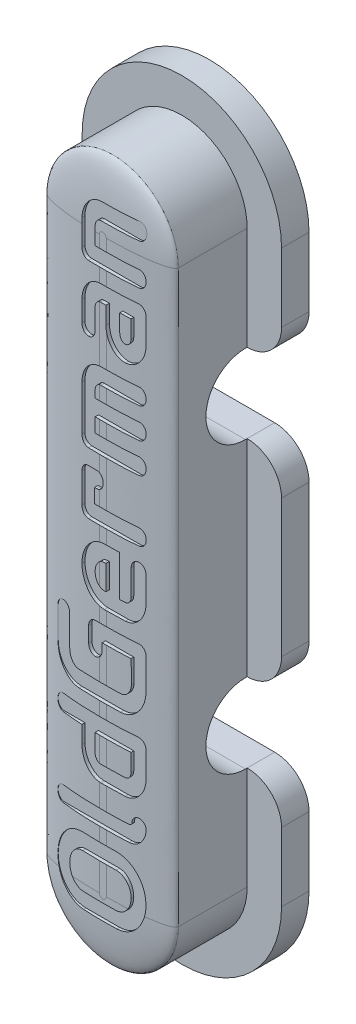
from build123d import *

# Parameters (mm, degrees)
EXTRUDE_1_DEPTH     = 3.1
EXTRUDE_2_DEPTH     = 0.8
FILLET_1_SIZE       = 0.3
FILLET_1_SIZE_2     = 1.8
SKETCH_3_R          = 1
SKETCH_3_R_2        = 1.096749421
EXTRUDE_3_DEPTH     = 1.05
SKETCH_6_W          = 5.8
SKETCH_6_H          = 2.3
CUT_EXTRUDE_2_DEPTH = 2
FILLET_4_R          = 1
FILLET_2_R          = 1.15
FILLET_3_R          = 1.15
FILLET_5_R          = 0.9
CUT_EXTRUDE_3_DEPTH = 0.1


# Some blends are built 0.0001 mm under size
with BuildPart() as part:
    # 草图1 → 凸台-拉伸1 (new body)
    with BuildSketch(Plane.XY):
        with BuildLine():
            Line((-1.3, -78.273), (-1.3, -61.672998253))
            ThreePointArc((-1.3, -61.672998253), (0.6, -59.772998253), (2.5, -61.672998253))
            Line((2.5, -61.672998253), (2.5, -78.273))
            ThreePointArc((2.5, -78.273), (0.6, -80.173), (-1.3, -78.273))
        make_face()
    extrude(amount=EXTRUDE_1_DEPTH)

    # 草图2 → 凸台-拉伸2 (add)
    with BuildSketch(Plane(origin=(0, 0, 0), x_dir=(-1, 0, 0), z_dir=(0, 0, -1))):
        with BuildLine():
            Line((2.3, -78.273), (2.3, -61.672998253))
            ThreePointArc((2.3, -61.672998253), (-0.6, -58.772998253), (-3.5, -61.672998253))
            Line((-3.5, -61.672998253), (-3.5, -78.273))
            ThreePointArc((-3.5, -78.273), (-0.6, -81.173), (2.3, -78.273))
        make_face()
    extrude(amount=-EXTRUDE_2_DEPTH)

    # 圆角1
    # an asymmetric fillet: 1.8, 0.3 mm, written as the material it takes off along each edge
    with BuildSketch(Plane(origin=(2.5, -61.672998253, 3.1), x_dir=(0, 0, -1), z_dir=(0, -1, 0)), Plane(origin=(-1.3, -78.273, 3.1), x_dir=(0, 0, -1), z_dir=(0, 1, 0))) as fillet_1_piece_1:
        with BuildLine():
            Bezier((FILLET_1_SIZE, 0), (0, 0), (0, -FILLET_1_SIZE_2), weights=[1, 0.707106781, 1])
            Line((0, -FILLET_1_SIZE_2), (0, 0))
            Line((0, 0), (FILLET_1_SIZE, 0))
        make_face()
    extrude(amount=16.600001747, mode=Mode.SUBTRACT)
    with BuildSketch(Plane(origin=(0.6, -61.672998253, 3.1), x_dir=(-1, 0, 0), z_dir=(0, -1, 0))) as fillet_1_piece_2:
        with BuildLine():
            Bezier((1.9, FILLET_1_SIZE), (1.9, 0), (1.9 - FILLET_1_SIZE_2, 0), weights=[1, 0.707106781, 1])
            Line((1.9 - FILLET_1_SIZE_2, 0), (1.9, 0))
            Line((1.9, 0), (1.9, FILLET_1_SIZE))
        make_face()
    revolve(axis=Axis((0.6, -61.672998253, 3.1), (0, 0, -1)), revolution_arc=180, mode=Mode.SUBTRACT)
    with BuildSketch(Plane(origin=(0.6, -78.273, 3.1), x_dir=(1, 0, 0), z_dir=(0, 1, 0))) as fillet_1_piece_3:
        with BuildLine():
            Bezier((1.9, FILLET_1_SIZE), (1.9, 0), (1.9 - FILLET_1_SIZE_2, 0), weights=[1, 0.707106781, 1])
            Line((1.9 - FILLET_1_SIZE_2, 0), (1.9, 0))
            Line((1.9, 0), (1.9, FILLET_1_SIZE))
        make_face()
    revolve(axis=Axis((0.6, -78.273, 3.1), (0, 0, -1)), revolution_arc=180, mode=Mode.SUBTRACT)

    # 草图3 → 凸台-拉伸3 (add)
    with BuildSketch(Plane(origin=(0, 0, 0), x_dir=(-1, 0, 0), z_dir=(0, 0, -1))):
        with Locations(Location((-0.6, -61.672998253, 0), (0, 0, 180))):
            Circle(SKETCH_3_R)
        with Locations(Location((-0.6, -69.972999126, 0), (0, 0, 180))):
            Circle(SKETCH_3_R_2)
        with Locations(Location((-0.6, -78.273, 0), (0, 0, 180))):
            Circle(SKETCH_3_R_2)
    extrude(amount=EXTRUDE_3_DEPTH)

    # 草图6 → 切除-拉伸2 (cut)
    with BuildSketch(Plane(origin=(0, 0, 0), x_dir=(-1, 0, 0), z_dir=(0, 0, -1))):
        with Locations((-0.6, -74.122999563)):
            Rectangle(SKETCH_6_W, SKETCH_6_H)
        with Locations((-0.6, -65.822998689)):
            Rectangle(SKETCH_6_W, SKETCH_6_H)
    extrude(amount=-CUT_EXTRUDE_2_DEPTH, mode=Mode.SUBTRACT)

    # 圆角4
    fillet_4_edges = [part.edges().sort_by_distance(p)[0] for p in [
        (-2.3, -75.272999563, 0.4),
        (-2.3, -64.672998689, 0.4),
        (3.5, -64.672998689, 0.4),
        (3.5, -66.972998689, 0.4),
        (-2.3, -66.972998689, 0.4),
        (-2.3, -72.972999563, 0.4),
        (3.5, -72.972999563, 0.4),
        (3.5, -75.272999563, 0.4),
    ]]
    fillet(fillet_4_edges, radius=FILLET_4_R)

    # 圆角2
    fillet_2_edges = [part.edges().sort_by_distance(p)[0] for p in [
        (0.6, -72.972999563, 2),
        (0.6, -75.272999563, 2),
    ]]
    fillet(fillet_2_edges, radius=FILLET_2_R - 0.0001)  # a hair under: the kernel refuses the full size

    # 圆角3
    fillet_3_edges = [part.edges().sort_by_distance(p)[0] for p in [
        (0.6, -66.972998689, 2),
        (0.6, -64.672998689, 2),
    ]]
    fillet(fillet_3_edges, radius=FILLET_3_R - 0.0001)  # a hair under: the kernel refuses the full size

    # 圆角5
    fillet_5_edges = [part.edges().sort_by_distance(p)[0] for p in [
        (-0.4, -61.672998253, 0),
        (-0.496749421, -69.972999126, 0),
        (-0.496749421, -78.273, 0),
    ]]
    fillet(fillet_5_edges, radius=FILLET_5_R)

    # 草图5 → 切除-拉伸3 (cut)
    # profile 1 of 9: a face of its own
    with BuildSketch(Plane.XY.offset(3.1)):
        with BuildLine():
            add(Edge.make_bspline(
                [(0.011216935, -76.987384224), (-0.016693673, -76.989324886), (-0.071778271, -76.993154994), (-0.152534844, -77.007935519), (-0.229669633, -77.031521379), (-0.303588619, -77.062633528), (-0.373743356, -77.102647355), (-0.440186185, -77.151061292), (-0.502597708, -77.208189748), (-0.561433758, -77.272268708), (-0.615248745, -77.342612369), (-0.661793995, -77.418839899), (-0.701938388, -77.499099179), (-0.735581561, -77.583892702), (-0.761916139, -77.673041916), (-0.780635247, -77.766821819), (-0.793766466, -77.864800436), (-0.796514307, -77.931865484), (-0.797916226, -77.966081346)],
                knots=[0, 0, 0, 0, 0.95443879, 1.883687951, 2.794728447, 3.702609083, 4.615393729, 5.544992927, 6.50269007, 7.498414936, 8.510915785, 9.520431137, 10.542172269, 11.570437658, 12.630057297, 13.710135553, 14.831735924, 16, 16, 16, 16], degree=3))
            add(Edge.make_bspline(
                [(-0.797916226, -77.966081346), (-0.796520158, -78.000298626), (-0.793783785, -78.067366454), (-0.780547104, -78.16549635), (-0.762109547, -78.259349444), (-0.735345473, -78.348540719), (-0.702087362, -78.433473361), (-0.661774079, -78.513843794), (-0.615254182, -78.590081026), (-0.561431926, -78.660420907), (-0.502599609, -78.724505176), (-0.440180644, -78.781616953), (-0.373762931, -78.830089969), (-0.303456771, -78.869923224), (-0.22980601, -78.901848656), (-0.152512984, -78.925204914), (-0.071831816, -78.940204966), (-0.016744611, -78.943593303), (0.011148814, -78.945308988)],
                knots=[0, 0, 0, 0, 1.16776754, 2.288891207, 3.374398935, 4.427806753, 5.461224648, 6.482531519, 7.491617807, 8.503688322, 9.498989984, 10.456280087, 11.385484186, 12.29788088, 13.207740602, 14.118393886, 15.047248097, 16, 16, 16, 16], degree=3))
            Line((0.011148814, -78.945308988), (0.986564766, -78.944781049))
            add(Edge.make_bspline(
                [(0.986564766, -78.944781049), (1.014322561, -78.943281032), (1.069290135, -78.940310611), (1.149807841, -78.925170219), (1.22710432, -78.901857832), (1.300754418, -78.869920879), (1.371059792, -78.830090161), (1.437481425, -78.781618633), (1.499884823, -78.724497901), (1.558778249, -78.660449628), (1.612423336, -78.58989817), (1.659815062, -78.514157614), (1.69920824, -78.433297124), (1.73274274, -78.348578005), (1.75922303, -78.259270536), (1.778563373, -78.165573165), (1.7915581, -78.067355429), (1.794328753, -78.000294902), (1.79574231, -77.966081346)],
                knots=[0, 0, 0, 0, 0.947768255, 1.876824959, 2.787676769, 3.697734842, 4.610330441, 5.539737109, 6.497235903, 7.492754544, 8.505045693, 9.517515298, 10.536370766, 11.570013949, 12.623651414, 13.710609808, 14.831977884, 16, 16, 16, 16], degree=3))
            add(Edge.make_bspline(
                [(1.79574231, -77.966081346), (1.794322796, -77.931869251), (1.791540468, -77.864811586), (1.778652269, -77.766744428), (1.759027662, -77.673121631), (1.732979203, -77.583855214), (1.699060653, -77.499274725), (1.659835165, -77.418525991), (1.612417854, -77.342795247), (1.558780091, -77.272239983), (1.49988292, -77.208197024), (1.437486966, -77.151059614), (1.371040222, -77.102647154), (1.30088625, -77.062635905), (1.226968, -77.0315121), (1.149829477, -77.007970702), (1.069124546, -76.993026058), (1.014040593, -76.989630139), (0.986148814, -76.987910615)],
                knots=[0, 0, 0, 0, 1.168232789, 2.289803123, 3.371073312, 4.430664575, 5.458902426, 6.477941663, 7.490593884, 8.503067617, 9.498765817, 10.456437313, 11.386011615, 12.298771817, 13.206628139, 14.117644237, 15.046868512, 16, 16, 16, 16], degree=3))
            Line((0.986148814, -76.987910615), (0.011216935, -76.987384224))
        make_face()
        with BuildLine():
            add(Edge.make_bspline(
                [(0.986564766, -77.456652516), (1.000714861, -77.457862133), (1.028775619, -77.460260899), (1.070080782, -77.467306756), (1.10966371, -77.4796448), (1.147029858, -77.496751748), (1.183064778, -77.51744336), (1.216830221, -77.543138422), (1.249159238, -77.572734821), (1.279252601, -77.60656701), (1.306165186, -77.643859441), (1.330997478, -77.683088646), (1.351451063, -77.724981997), (1.368492129, -77.768993396), (1.381524152, -77.815235617), (1.391776058, -77.863565653), (1.397956101, -77.914148183), (1.399616993, -77.948627482), (1.400457757, -77.966081346)],
                knots=[0, 0, 0, 0, 0.939469275, 1.863041863, 2.766166559, 3.673791904, 4.577292511, 5.509647286, 6.474716113, 7.473535843, 8.499192312, 9.51466749, 10.541448982, 11.578169742, 12.633137513, 13.716561243, 14.84409392, 16, 16, 16, 16], degree=3))
            add(Edge.make_bspline(
                [(1.400457757, -77.966081346), (1.399636278, -77.983713686), (1.398029604, -78.018199545), (1.391655472, -78.068928345), (1.381609295, -78.117296775), (1.368482217, -78.163695827), (1.351453672, -78.207709659), (1.330996789, -78.249602362), (1.306165376, -78.288831768), (1.279252536, -78.326124033), (1.249159308, -78.359956668), (1.216830014, -78.389551523), (1.183065504, -78.415252051), (1.147027237, -78.435923987), (1.109673532, -78.453104108), (1.070013112, -78.46517738), (1.02873391, -78.473298868), (1.000453678, -78.475119682), (0.986148814, -78.476040696)],
                knots=[0, 0, 0, 0, 1.165960287, 2.280420115, 3.373774092, 4.42731502, 5.462633617, 6.488026387, 7.502128136, 8.526397406, 9.523866233, 10.487629805, 11.418723571, 12.321002194, 13.227399977, 14.129303198, 15.053753771, 16, 16, 16, 16], degree=3))
            Line((0.986148814, -78.476040696), (0.011216935, -78.475512757))
            add(Edge.make_bspline(
                [(0.011216935, -78.475512757), (-0.003114509, -78.474815909), (-0.03143892, -78.473438671), (-0.072712632, -78.46514174), (-0.112376653, -78.453113605), (-0.14972945, -78.435921473), (-0.185767762, -78.415252667), (-0.219533033, -78.389551661), (-0.251859073, -78.359955406), (-0.281965131, -78.32612918), (-0.30882866, -78.288812038), (-0.333802337, -78.249740601), (-0.353545463, -78.207574804), (-0.370539765, -78.163619103), (-0.384482584, -78.117393946), (-0.394275678, -78.068913157), (-0.400877964, -78.018220087), (-0.402038473, -77.983717507), (-0.402631674, -77.966081346)],
                knots=[0, 0, 0, 0, 0.946924655, 1.871484914, 2.773495147, 3.680000475, 4.582386154, 5.513590395, 6.477468318, 7.475055495, 8.499446295, 9.513668368, 10.53408351, 11.569524948, 12.626464836, 13.719948541, 14.8345406, 16, 16, 16, 16], degree=3))
            add(Edge.make_bspline(
                [(-0.402631674, -77.966081346), (-0.402018726, -77.948623672), (-0.400807541, -77.914127318), (-0.394395595, -77.86358098), (-0.384395341, -77.815139039), (-0.370549457, -77.769070176), (-0.353542929, -77.725116833), (-0.333803008, -77.682950411), (-0.308828474, -77.64387917), (-0.281965194, -77.606561864), (-0.251859005, -77.57273608), (-0.219533237, -77.543138294), (-0.185767048, -77.517442713), (-0.149732028, -77.496754375), (-0.112366992, -77.479634876), (-0.072779702, -77.467343959), (-0.031371025, -77.460096433), (-0.003144923, -77.458159681), (0.011148814, -77.457178907)],
                knots=[0, 0, 0, 0, 1.154856541, 2.281995816, 3.365041533, 4.422918079, 5.459277122, 6.480596553, 7.495717427, 8.521016039, 9.519487276, 10.484219384, 11.416248856, 12.319434227, 13.226742898, 14.129552489, 15.052802838, 16, 16, 16, 16], degree=3))
            Line((0.011148814, -77.457178907), (0.986564766, -77.456652516))
        make_face(mode=Mode.SUBTRACT)
    # profile 2 of 9: a face of its own
    with BuildSketch(Plane.XY.offset(3.1)):
        with BuildLine():
            add(Edge.make_bspline(
                [(1.801026863, -76.084072073), (1.800123807, -76.068356418), (1.798386085, -76.038115276), (1.78759114, -75.994787621), (1.770052804, -75.956056416), (1.74679492, -75.921854279), (1.718350115, -75.893924974), (1.686072691, -75.872505654), (1.649581762, -75.859387941), (1.623921389, -75.857050502), (1.610782961, -75.855853704)],
                knots=[0, 0, 0, 0, 1.146539465, 2.20624998, 3.235764897, 4.233840532, 5.206185862, 6.125809605, 7.040391315, 8, 8, 8, 8], degree=3))
            add(Edge.make_bspline(
                [(1.610782961, -75.855853704), (1.597298643, -75.857058003), (1.570963332, -75.859410039), (1.533535018, -75.872359444), (1.500578544, -75.893900341), (1.471694487, -75.921852823), (1.447628544, -75.95576471), (1.430978903, -75.994949122), (1.419949145, -76.0381139), (1.418251316, -76.068397046), (1.417368326, -76.084146387)],
                knots=[0, 0, 0, 0, 0.976100452, 1.9063559, 2.828294777, 3.800900527, 4.797142443, 5.812088704, 6.862134105, 8, 8, 8, 8], degree=3))
            add(Edge.make_bspline(
                [(1.417368326, -76.084146387), (1.413029886, -76.09035136), (1.404743569, -76.10220271), (1.388953271, -76.115912737), (1.372291255, -76.126913748), (1.359732739, -76.130104707), (1.353425237, -76.131707362)],
                knots=[0, 0, 0, 0, 1.106007569, 2.112448186, 3.051979138, 4, 4, 4, 4], degree=3))
            Line((1.353425237, -76.131707362), (-0.613294386, -76.131456037))
            add(Edge.make_bspline(
                [(-0.613294386, -76.131456037), (-0.626332318, -76.132520535), (-0.651748529, -76.134595675), (-0.687812771, -76.148014779), (-0.719995084, -76.16906274), (-0.747871771, -76.197393246), (-0.771125436, -76.231124914), (-0.788203361, -76.269625091), (-0.798314893, -76.312469487), (-0.800137469, -76.342330065), (-0.801086958, -76.357886224)],
                knots=[0, 0, 0, 0, 0.959435098, 1.870327626, 2.79850931, 3.770688842, 4.778052484, 5.800006748, 6.853892094, 8, 8, 8, 8], degree=3))
            add(Edge.make_bspline(
                [(-0.801086958, -76.357886224), (-0.800119346, -76.373438526), (-0.79825133, -76.403462882), (-0.788302449, -76.446522091), (-0.771124858, -76.485185523), (-0.747846498, -76.518866988), (-0.720157741, -76.547314187), (-0.68764317, -76.567683086), (-0.651809024, -76.581120538), (-0.62646265, -76.583417499), (-0.613485332, -76.584593541)],
                knots=[0, 0, 0, 0, 1.145841184, 2.212093514, 3.233809949, 4.240939159, 5.212892446, 6.133855195, 7.044535741, 8, 8, 8, 8], degree=3))
            Line((-0.613485332, -76.584593541), (1.353542385, -76.584065602))
            add(Edge.make_bspline(
                [(1.353542385, -76.584065602), (1.368689789, -76.583364497), (1.398695092, -76.581975686), (1.44254165, -76.573701298), (1.484808838, -76.561656007), (1.524961504, -76.544584692), (1.563269844, -76.523385749), (1.599380513, -76.497632067), (1.634045193, -76.468059594), (1.665777535, -76.433641539), (1.695410488, -76.396658974), (1.720619814, -76.356480474), (1.743382884, -76.31479934), (1.760741864, -76.270161817), (1.776272437, -76.223817112), (1.786263446, -76.174818426), (1.793488423, -76.123628722), (1.794980213, -76.088752091), (1.79574231, -76.070935005)],
                knots=[0, 0, 0, 0, 0.969050169, 1.91957938, 2.846842253, 3.776157352, 4.704378495, 5.642399312, 6.609289039, 7.613865083, 8.632938648, 9.636439501, 10.644738196, 11.665990401, 12.69597274, 13.768007411, 14.859763632, 16, 16, 16, 16], degree=3))
            Line((1.79574231, -76.070935005), (1.801026863, -76.084072073))
        make_face()
    # profile 3 of 9: a face of its own
    with BuildSketch(Plane.XY.offset(3.1)):
        with BuildLine():
            add(Edge.make_bspline(
                [(1.238390224, -75.474732269), (1.257417355, -75.473822138), (1.294933342, -75.472027625), (1.349658376, -75.460709216), (1.402561479, -75.445274895), (1.452745611, -75.42250202), (1.501405955, -75.395274149), (1.546713024, -75.360796399), (1.590431011, -75.321744856), (1.630656686, -75.276723475), (1.668085715, -75.227999586), (1.701113018, -75.175583988), (1.728311271, -75.119685304), (1.751931084, -75.061368377), (1.77022146, -74.999935673), (1.784193201, -74.935674074), (1.79244788, -74.868260832), (1.79462959, -74.822285754), (1.79574231, -74.798837444)],
                knots=[0, 0, 0, 0, 0.942526683, 1.858389432, 2.761349701, 3.668015128, 4.582879026, 5.518617029, 6.482748756, 7.483867004, 8.505178413, 9.524809879, 10.547575006, 11.581712154, 12.639343413, 13.719640775, 14.836966202, 16, 16, 16, 16], degree=3))
            Line((1.79574231, -74.798837444), (1.79574231, -74.058596995))
            add(Edge.make_bspline(
                [(1.79574231, -74.058596995), (1.794877315, -74.04262684), (1.793194835, -74.011563705), (1.781680787, -73.967297722), (1.764327523, -73.926799963), (1.739816042, -73.891712002), (1.711075602, -73.86158281), (1.677270509, -73.839590168), (1.639626451, -73.825650929), (1.613190872, -73.823401349), (1.5996854, -73.822252078)],
                knots=[0, 0, 0, 0, 1.126897176, 2.191898422, 3.211167379, 4.222128699, 5.198519621, 6.133542748, 7.046459767, 8, 8, 8, 8], degree=3))
            Line((1.5996854, -73.822252078), (-0.612145615, -73.821725171))
            add(Edge.make_bspline(
                [(-0.612145615, -73.821725171), (-0.625206809, -73.82311147), (-0.650830191, -73.825831106), (-0.687353683, -73.839434411), (-0.719670585, -73.861854188), (-0.747357048, -73.891733751), (-0.770667103, -73.927005155), (-0.787619892, -73.967317066), (-0.798425441, -74.011772391), (-0.800180011, -74.0429066), (-0.801086958, -74.059000045)],
                knots=[0, 0, 0, 0, 0.938112965, 1.840385105, 2.757270954, 3.730092353, 4.74142436, 5.770234776, 6.847421918, 8, 8, 8, 8], degree=3))
            add(Edge.make_bspline(
                [(-0.801086958, -74.059000045), (-0.800179945, -74.074917753), (-0.798425658, -74.105704776), (-0.787625915, -74.149644574), (-0.770637343, -74.189417489), (-0.747488982, -74.2241204), (-0.719639727, -74.253129536), (-0.687035895, -74.274162482), (-0.650994428, -74.288084545), (-0.62541118, -74.290363743), (-0.612428422, -74.291520371)],
                knots=[0, 0, 0, 0, 1.152628329, 2.229340808, 3.257817537, 4.269704843, 5.23492312, 6.147806245, 7.060065237, 8, 8, 8, 8], degree=3))
            Line((-0.612428422, -74.291520371), (-0.020029532, -74.290993464))
            Line((-0.020029532, -74.290993464), (-0.020029532, -74.798766742))
            add(Edge.make_bspline(
                [(-0.020029532, -74.798766742), (-0.018918068, -74.822238774), (-0.016739892, -74.868237794), (-0.008478294, -74.93567296), (0.005481963, -74.99993963), (0.023812976, -75.061354073), (0.047315159, -75.119810338), (0.075139178, -75.175617164), (0.108754944, -75.227828963), (0.146047637, -75.276939385), (0.18690755, -75.321540448), (0.230594289, -75.361007781), (0.276372154, -75.395106252), (0.325063484, -75.422520487), (0.375412438, -75.445367059), (0.428704718, -75.460731687), (0.483859445, -75.471869778), (0.521582285, -75.474121417), (0.540661009, -75.475260208)],
                knots=[0, 0, 0, 0, 1.161077911, 2.275407906, 3.352809105, 4.407604967, 5.438969703, 6.462886066, 7.484431221, 8.503004602, 9.50730425, 10.468851242, 11.409078786, 12.32149003, 13.225724783, 14.134599134, 15.056553867, 16, 16, 16, 16], degree=3))
            Line((0.540661009, -75.475260208), (1.238390224, -75.474732269))
        make_face()
        with BuildLine():
            Line((0.375255021, -74.290993464), (1.400457757, -74.290993464))
            Line((1.400457757, -74.290993464), (1.400457757, -74.798766742))
            add(Edge.make_bspline(
                [(1.400457757, -74.798766742), (1.399701138, -74.812771652), (1.398237682, -74.839860027), (1.388249114, -74.87851153), (1.373571145, -74.913799969), (1.353490967, -74.944855402), (1.329602552, -74.971193453), (1.301374556, -74.989669576), (1.271040259, -75.003062701), (1.249285649, -75.005004421), (1.238221985, -75.005991915)],
                knots=[0, 0, 0, 0, 1.158458662, 2.240697287, 3.286157774, 4.309519527, 5.289576018, 6.203619967, 7.086421449, 8, 8, 8, 8], degree=3))
            Line((1.238221985, -75.005991915), (0.540795187, -75.005463976))
            add(Edge.make_bspline(
                [(0.540795187, -75.005463976), (0.529335751, -75.004696811), (0.506833882, -75.003190399), (0.47553708, -74.989791723), (0.446660651, -74.97122593), (0.422255824, -74.94487953), (0.401585584, -74.91394434), (0.386807677, -74.878573967), (0.377651771, -74.839802023), (0.376071904, -74.812805192), (0.375254505, -74.798837444)],
                knots=[0, 0, 0, 0, 0.934576908, 1.835145018, 2.751876845, 3.731874022, 4.752687054, 5.787485867, 6.855278908, 8, 8, 8, 8], degree=3))
            Line((0.375254505, -74.798837444), (0.375255021, -74.290993464))
        make_face(mode=Mode.SUBTRACT)
    # profile 4 of 9: a face of its own
    with BuildSketch(Plane.XY.offset(3.1)):
        with BuildLine():
            add(Edge.make_bspline(
                [(1.410183605, -72.584758017), (1.40768133, -72.609808401), (1.402830763, -72.658367623), (1.383541755, -72.727384046), (1.354789715, -72.78950941), (1.31742992, -72.843841792), (1.273381111, -72.889070153), (1.223275233, -72.923045841), (1.167316524, -72.943842002), (1.128116579, -72.947705782), (1.108221985, -72.949666712)],
                knots=[0, 0, 0, 0, 1.160381443, 2.249355472, 3.289739044, 4.306923674, 5.278600684, 6.187416734, 7.080085207, 8, 8, 8, 8], degree=3))
            Line((1.108221985, -72.949666712), (-0.108083909, -72.949138773))
            add(Edge.make_bspline(
                [(-0.108083909, -72.949138773), (-0.128235844, -72.947431403), (-0.167733208, -72.944084994), (-0.223943645, -72.922867392), (-0.274422197, -72.889246064), (-0.318518316, -72.844071022), (-0.355038344, -72.789645956), (-0.38126972, -72.727326535), (-0.398971329, -72.658733866), (-0.401383419, -72.610514506), (-0.402631674, -72.585561021)],
                knots=[0, 0, 0, 0, 0.933576498, 1.829790135, 2.74901888, 3.724554832, 4.736602349, 5.767762173, 6.844818481, 8, 8, 8, 8], degree=3))
            Line((-0.402631674, -72.585561021), (-0.402630641, -71.692590802))
            add(Edge.make_bspline(
                [(-0.402630641, -71.692590802), (-0.403484215, -71.676621472), (-0.405135448, -71.645728881), (-0.41667843, -71.601798217), (-0.434013513, -71.562106123), (-0.45800069, -71.527600609), (-0.486791193, -71.498864536), (-0.520448769, -71.477578326), (-0.558306492, -71.46442858), (-0.585020777, -71.462515446), (-0.598688584, -71.461536631)],
                knots=[0, 0, 0, 0, 1.137300663, 2.200102668, 3.217432155, 4.210055022, 5.17782923, 6.097493112, 7.026622051, 8, 8, 8, 8], degree=3))
            add(Edge.make_bspline(
                [(-0.598688584, -71.461536631), (-0.612365794, -71.462499915), (-0.639098458, -71.464382694), (-0.677108995, -71.477852584), (-0.711596494, -71.498612166), (-0.740880048, -71.527757403), (-0.766040875, -71.5618848), (-0.783947707, -71.601700097), (-0.795422245, -71.645868858), (-0.797064051, -71.676895659), (-0.797916226, -71.693000045)],
                knots=[0, 0, 0, 0, 0.966165885, 1.888410615, 2.822453195, 3.791989156, 4.791655316, 5.806586792, 6.861514161, 8, 8, 8, 8], degree=3))
            Line((-0.797916226, -71.693000045), (-0.79791571, -72.585464516))
            add(Edge.make_bspline(
                [(-0.79791571, -72.585464516), (-0.796758921, -72.61459256), (-0.794488465, -72.671762818), (-0.783834002, -72.755585468), (-0.767047568, -72.83549111), (-0.743905207, -72.911480755), (-0.71650627, -72.9840563), (-0.681524715, -73.052341442), (-0.640906208, -73.116636388), (-0.595038875, -73.176863722), (-0.544853895, -73.231450667), (-0.490962965, -73.279258384), (-0.434967159, -73.321012808), (-0.375372531, -73.355147695), (-0.312519065, -73.381358975), (-0.247193618, -73.401882238), (-0.178675722, -73.414621035), (-0.13193647, -73.417485381), (-0.10828208, -73.418935005)],
                knots=[0, 0, 0, 0, 1.167827455, 2.292120889, 3.381771476, 4.43592474, 5.472919106, 6.486361953, 7.504808276, 8.517168701, 9.516323912, 10.471334558, 11.400396663, 12.311038216, 13.215750048, 14.124556429, 15.050851903, 16, 16, 16, 16], degree=3))
            Line((-0.10828208, -73.418935005), (1.108550205, -73.418407066))
            add(Edge.make_bspline(
                [(1.108550205, -73.418407066), (1.132099844, -73.417184521), (1.178578878, -73.414771632), (1.246607218, -73.401840585), (1.311421561, -73.381384572), (1.373842379, -73.355009267), (1.433335613, -73.321034821), (1.489287286, -73.279228542), (1.543230802, -73.231631061), (1.592799502, -73.17665057), (1.638829372, -73.116819698), (1.678777486, -73.052186354), (1.713661572, -72.983946519), (1.742031045, -72.911700564), (1.764119278, -72.835370442), (1.781230092, -72.755607337), (1.791629922, -72.671771553), (1.794354607, -72.614652302), (1.79574231, -72.585561021)],
                knots=[0, 0, 0, 0, 0.946232588, 1.867543542, 2.771525593, 3.671651626, 4.584229579, 5.515267253, 6.472308646, 7.468803567, 8.483316688, 9.500170379, 10.515768225, 11.557541049, 12.611920467, 13.7038881, 14.830572247, 16, 16, 16, 16], degree=3))
            Line((1.79574231, -72.585561021), (1.79574231, -71.692590802))
            add(Edge.make_bspline(
                [(1.79574231, -71.692590802), (1.794941132, -71.676607937), (1.793389012, -71.645644381), (1.781093326, -71.601786028), (1.763382666, -71.561873158), (1.738166298, -71.527760403), (1.708897009, -71.498611405), (1.674405878, -71.47785278), (1.636396282, -71.464382642), (1.609663488, -71.462499898), (1.595986213, -71.461536631)],
                knots=[0, 0, 0, 0, 1.129783229, 2.188725572, 3.204476398, 4.204949585, 5.175268249, 6.110064878, 7.033054133, 8, 8, 8, 8], degree=3))
            Line((1.595986213, -71.461536631), (0.382398457, -71.46101024))
            add(Edge.make_bspline(
                [(0.382398457, -71.46101024), (0.368634031, -71.462186172), (0.341837846, -71.464475442), (0.303699634, -71.477817962), (0.269217742, -71.498621878), (0.239932615, -71.52775467), (0.214772228, -71.561885553), (0.196865274, -71.601699886), (0.185390771, -71.645868916), (0.18374896, -71.676895679), (0.182896782, -71.693000045)],
                knots=[0, 0, 0, 0, 0.973130344, 1.894461925, 2.827579675, 3.796155663, 4.794832016, 5.808758571, 6.862641418, 8, 8, 8, 8], degree=3))
            Line((0.182896782, -71.693000045), (0.182897298, -72.133968629))
            add(Edge.make_bspline(
                [(0.182897298, -72.133968629), (0.183758473, -72.150166495), (0.185421928, -72.181454447), (0.196834243, -72.226095248), (0.214926678, -72.266458971), (0.239708194, -72.301587393), (0.269367582, -72.331158268), (0.303483366, -72.353178084), (0.341674928, -72.367073914), (0.368446531, -72.369328055), (0.382124424, -72.37047972)],
                knots=[0, 0, 0, 0, 1.134260005, 2.19094747, 3.207293139, 4.21739958, 5.186168446, 6.124261137, 7.041665307, 8, 8, 8, 8], degree=3))
            add(Edge.make_bspline(
                [(0.382124424, -72.37047972), (0.395792363, -72.369312445), (0.422544484, -72.36702775), (0.460596582, -72.353455744), (0.493862719, -72.330907185), (0.523039923, -72.301738142), (0.546642762, -72.266244159), (0.564165195, -72.22599764), (0.575657112, -72.181556479), (0.577321941, -72.150362633), (0.578181335, -72.134260208)],
                knots=[0, 0, 0, 0, 0.964998293, 1.888781459, 2.812564626, 3.779242082, 4.782304087, 5.800648234, 6.864683176, 8, 8, 8, 8], degree=3))
            Line((0.578181335, -72.134260208), (0.578181851, -71.928574987))
            Line((0.578181851, -71.928574987), (1.400457757, -71.928574987))
            Line((1.400457757, -71.928574987), (1.410183605, -72.584758017))
        make_face()
    # profile 5 of 9: a face of its own
    with BuildSketch(Plane.XY.offset(3.1)):
        with BuildLine():
            Line((1.085498924, -69.40468452), (0.64619002, -69.40468452))
            add(Edge.make_bspline(
                [(0.64619002, -69.40468452), (0.623642624, -69.406341023), (0.579064, -69.409616107), (0.513852183, -69.422425246), (0.451201487, -69.442099602), (0.391355716, -69.469270779), (0.333988606, -69.503346147), (0.279136607, -69.544319885), (0.22739637, -69.592801347), (0.178548365, -69.647425848), (0.133978037, -69.707476871), (0.093962949, -69.771351264), (0.06082983, -69.839603029), (0.032604527, -69.911068652), (0.010355044, -69.986587315), (-0.005773967, -70.065800766), (-0.016640611, -70.148642483), (-0.018886289, -70.205083203), (-0.020030048, -70.233829314)],
                knots=[0, 0, 0, 0, 0.923665058, 1.82618503, 2.709918895, 3.60276125, 4.506860185, 5.433005949, 6.39613021, 7.400896498, 8.42498895, 9.450220282, 10.477649867, 11.522126638, 12.588568936, 13.69165935, 14.824327235, 16, 16, 16, 16], degree=3))
            add(Edge.make_bspline(
                [(-0.020030048, -70.233829314), (-0.018892059, -70.262399798), (-0.016664874, -70.318315793), (-0.005788281, -70.400283569), (0.010437779, -70.478590905), (0.032574317, -70.553440581), (0.060978402, -70.624468039), (0.093794336, -70.692533478), (0.134146779, -70.756029287), (0.178554363, -70.815988041), (0.227218584, -70.8706485), (0.27931947, -70.918561936), (0.333970185, -70.959568343), (0.391346297, -70.993671315), (0.451305342, -71.02065795), (0.51374637, -71.041136364), (0.578931084, -71.053876014), (0.623399689, -71.056763501), (0.645823611, -71.058219558)],
                knots=[0, 0, 0, 0, 1.173145474, 2.295991786, 3.389326865, 4.45309377, 5.495012025, 6.526542102, 7.549726577, 8.577906204, 9.586682534, 10.54874524, 11.478587271, 12.386294483, 13.282700191, 14.172167919, 15.078289867, 16, 16, 16, 16], degree=3))
            Line((0.645823611, -71.058219558), (1.244681112, -71.057691618))
            add(Edge.make_bspline(
                [(1.244681112, -71.057691618), (1.263375548, -71.056787788), (1.300214871, -71.055006695), (1.354046923, -71.043575142), (1.406139884, -71.028337882), (1.45541973, -71.005457053), (1.503083214, -70.978061169), (1.54780643, -70.943776716), (1.590984527, -70.904532877), (1.631154508, -70.859675534), (1.66874788, -70.811140773), (1.700859854, -70.758213446), (1.72913985, -70.702942041), (1.751727004, -70.644170774), (1.77028309, -70.582921266), (1.784176007, -70.518626102), (1.792452447, -70.451222126), (1.794631132, -70.40524576), (1.79574231, -70.381796793)],
                knots=[0, 0, 0, 0, 0.931216621, 1.83505887, 2.734756502, 3.630548451, 4.535413243, 5.469444943, 6.432560396, 7.439371832, 8.466491262, 9.487288971, 10.519796213, 11.556586114, 12.62023194, 13.706672766, 14.830352229, 16, 16, 16, 16], degree=3))
            Line((1.79574231, -70.381796793), (1.79574231, -69.641556345))
            add(Edge.make_bspline(
                [(1.79574231, -69.641556345), (1.794877315, -69.625586189), (1.793194835, -69.594523055), (1.781680787, -69.550257071), (1.764327523, -69.509759313), (1.739816042, -69.474671351), (1.711075602, -69.44454216), (1.677270509, -69.422549518), (1.639626451, -69.408610279), (1.613190872, -69.406360699), (1.5996854, -69.405211428)],
                knots=[0, 0, 0, 0, 1.126897176, 2.191898422, 3.211167379, 4.222128699, 5.198519621, 6.133542748, 7.046459767, 8, 8, 8, 8], degree=3))
            add(Edge.make_bspline(
                [(1.5996854, -69.405211428), (1.585835153, -69.406368468), (1.558727425, -69.408633029), (1.520128377, -69.422392978), (1.485706331, -69.444544681), (1.456371373, -69.474489213), (1.431895354, -69.509781135), (1.414513334, -69.550250914), (1.402971154, -69.594655176), (1.401313465, -69.625854264), (1.400457757, -69.641959395)],
                knots=[0, 0, 0, 0, 0.96891525, 1.896362752, 2.832850791, 3.808635652, 4.809989248, 5.819571528, 6.874451479, 8, 8, 8, 8], degree=3))
            Line((1.400457757, -69.641959395), (1.400457757, -70.381726092))
            add(Edge.make_bspline(
                [(1.400457757, -70.381726092), (1.399652521, -70.395721252), (1.398097422, -70.422749164), (1.388807676, -70.461428049), (1.374659865, -70.496741846), (1.355064492, -70.527601318), (1.332313529, -70.554095223), (1.305109626, -70.57259413), (1.275997108, -70.58594204), (1.255099496, -70.587942622), (1.244563448, -70.588951265)],
                knots=[0, 0, 0, 0, 1.177717652, 2.274446914, 3.331586134, 4.364008909, 5.340304702, 6.24509898, 7.115223326, 8, 8, 8, 8], degree=3))
            Line((1.244563448, -70.588951265), (1.085498924, -70.588423326))
            Line((1.085498924, -70.588423326), (1.085498924, -69.40468452))
        make_face()
        with BuildLine():
            add(Edge.make_bspline(
                [(0.375255021, -70.233443294), (0.376430464, -70.209168455), (0.378709521, -70.162102182), (0.394626957, -70.094763899), (0.418577032, -70.033174951), (0.452403408, -69.979462541), (0.492847331, -69.934746697), (0.538915283, -69.900857223), (0.590782882, -69.879634307), (0.627314762, -69.876213082), (0.645823611, -69.87447972)],
                knots=[0, 0, 0, 0, 1.173689533, 2.275656417, 3.331297314, 4.357595055, 5.328798802, 6.232391115, 7.10444229, 8, 8, 8, 8], degree=3))
            Line((0.645823611, -69.87447972), (0.690213855, -69.873952813))
            Line((0.690213855, -69.873952813), (0.690213855, -70.588423326))
            Line((0.690213855, -70.588423326), (0.64619002, -70.588423326))
            add(Edge.make_bspline(
                [(0.64619002, -70.588423326), (0.627537636, -70.58694309), (0.590816901, -70.584028968), (0.539259764, -70.562398532), (0.492677847, -70.529899795), (0.452435808, -70.485529989), (0.418718802, -70.432523133), (0.394513692, -70.371717634), (0.378697358, -70.304901214), (0.376428084, -70.258055862), (0.375255021, -70.233443294)],
                knots=[0, 0, 0, 0, 0.905337752, 1.782328134, 2.681120957, 3.651524479, 4.676384823, 5.722107799, 6.821964958, 8, 8, 8, 8], degree=3))
        make_face(mode=Mode.SUBTRACT)
    # profile 6 of 9: a face of its own
    with BuildSketch(Plane.XY.offset(3.1)):
        with BuildLine():
            add(Edge.make_bspline(
                [(1.611084345, -68.997465961), (1.624150045, -68.996621191), (1.64985348, -68.994959321), (1.685935248, -68.980809999), (1.718541902, -68.959663136), (1.746788083, -68.931062184), (1.770051585, -68.896394945), (1.787794932, -68.856828574), (1.798306343, -68.812349682), (1.80009981, -68.781231532), (1.801026863, -68.765146387)],
                knots=[0, 0, 0, 0, 0.939412827, 1.848055395, 2.757319621, 3.727654124, 4.724982834, 5.754491679, 6.839284224, 8, 8, 8, 8], degree=3))
            add(Edge.make_bspline(
                [(1.801026863, -68.765146387), (1.80012294, -68.749407525), (1.798384858, -68.719144527), (1.7876187, -68.675769081), (1.769892638, -68.636990154), (1.746979039, -68.602377333), (1.718331586, -68.57439983), (1.686073268, -68.553008988), (1.649619017, -68.539734471), (1.623926759, -68.53782868), (1.610782961, -68.536853704)],
                knots=[0, 0, 0, 0, 1.146794116, 2.205078657, 3.233208232, 4.240542482, 5.211579399, 6.129965672, 7.043316697, 8, 8, 8, 8], degree=3))
            Line((1.610782961, -68.536853704), (0.354541535, -68.536494519))
            Line((0.354541535, -68.536494519), (0.354541535, -68.128205528))
            Line((0.354541535, -68.128205528), (0.425646123, -68.123809131))
            add(Edge.make_bspline(
                [(0.425646123, -68.123809131), (0.438376585, -68.12273227), (0.463480133, -68.120608778), (0.499258265, -68.107295716), (0.531431506, -68.086238058), (0.559449176, -68.057845131), (0.582564388, -68.023860927), (0.599044232, -67.984651257), (0.609848102, -67.941672624), (0.611619705, -67.911405379), (0.612530928, -67.895837444)],
                knots=[0, 0, 0, 0, 0.935850102, 1.845428568, 2.772271248, 3.743048305, 4.759657985, 5.774946749, 6.85554548, 8, 8, 8, 8], degree=3))
            add(Edge.make_bspline(
                [(0.612530928, -67.895837444), (0.611633769, -67.879739627), (0.609898136, -67.848596962), (0.599015152, -67.804426274), (0.582725828, -67.764239411), (0.559425369, -67.729670289), (0.531610209, -67.700671423), (0.499237907, -67.679656794), (0.463440969, -67.666231092), (0.438255941, -67.664298962), (0.425457757, -67.663317119)],
                knots=[0, 0, 0, 0, 1.16687827, 2.257430216, 3.282265658, 4.295492622, 5.26198877, 6.176080479, 7.073145486, 8, 8, 8, 8], degree=3))
            Line((0.425457757, -67.663317119), (0.177610681, -67.66283769))
            add(Edge.make_bspline(
                [(0.177610681, -67.66283769), (0.163758264, -67.663970496), (0.13703461, -67.66615587), (0.099136075, -67.67958588), (0.065213879, -67.700608192), (0.035735304, -67.729414786), (0.011452644, -67.764190528), (-0.006083712, -67.804256249), (-0.017497767, -67.848541367), (-0.019167911, -67.879735084), (-0.020030048, -67.895837444)],
                knots=[0, 0, 0, 0, 0.979723931, 1.89005317, 2.813338772, 3.782730591, 4.785195421, 5.794837066, 6.861683421, 8, 8, 8, 8], degree=3))
            Line((-0.020030048, -67.895837444), (-0.020029532, -68.764500784))
            add(Edge.make_bspline(
                [(-0.020029532, -68.764500784), (-0.019190932, -68.780999259), (-0.017576284, -68.812765577), (-0.005956911, -68.857886739), (0.011280291, -68.89879028), (0.035762521, -68.934129726), (0.065018261, -68.963606128), (0.099266472, -68.98441192), (0.136748949, -68.998617634), (0.163388535, -69.000781781), (0.177083774, -69.001894354)],
                knots=[0, 0, 0, 0, 1.155295002, 2.224415809, 3.247480974, 4.250985735, 5.22017508, 6.13506575, 7.041249356, 8, 8, 8, 8], degree=3))
            Line((0.177083774, -69.001894354), (1.611084345, -68.997465961))
        make_face()
    # profile 7 of 9: a face of its own
    with BuildSketch(Plane.XY.offset(3.1)):
        with BuildLine():
            add(Edge.make_bspline(
                [(-0.020029532, -66.978744686), (-0.019203828, -66.994897035), (-0.017614869, -67.025980161), (-0.005751002, -67.070314501), (0.011248364, -67.110929752), (0.035888985, -67.146343491), (0.065155006, -67.176105299), (0.098941701, -67.198329985), (0.136827021, -67.212147397), (0.163407419, -67.214782449), (0.177083774, -67.216138257)],
                knots=[0, 0, 0, 0, 1.134229186, 2.182678794, 3.208944308, 4.215588229, 5.196528331, 6.127558359, 7.036576686, 8, 8, 8, 8], degree=3))
            Line((0.177083774, -67.216138257), (1.61197663, -67.215610318))
            add(Edge.make_bspline(
                [(1.61197663, -67.215610318), (1.624731675, -67.214437263), (1.649914461, -67.212121256), (1.685817887, -67.198247019), (1.718046407, -67.176037966), (1.745650837, -67.146097112), (1.769305721, -67.110873688), (1.785078581, -67.070157222), (1.796383309, -67.025959151), (1.798047866, -66.994969259), (1.798913042, -66.978861834)],
                knots=[0, 0, 0, 0, 0.918677873, 1.813781688, 2.735446954, 3.713339345, 4.729943085, 5.770937527, 6.841413916, 8, 8, 8, 8], degree=3))
            add(Edge.make_bspline(
                [(1.798913042, -66.978861834), (1.798021874, -66.962937322), (1.796298234, -66.932137137), (1.785300305, -66.888356951), (1.769117688, -66.848314762), (1.745800055, -66.813766398), (1.718011294, -66.784703089), (1.685503632, -66.763877417), (1.649943761, -66.749630611), (1.624658003, -66.747798645), (1.611839871, -66.746869964)],
                knots=[0, 0, 0, 0, 1.157147383, 2.238081277, 3.265574424, 4.281428989, 5.25043155, 6.166893773, 7.070741875, 8, 8, 8, 8], degree=3))
            Line((1.611839871, -66.746869964), (0.375255021, -66.746342025))
            Line((0.375255021, -66.746342025), (0.375255021, -66.336261756))
            Line((0.375255021, -66.336261756), (1.61197663, -66.336261756))
            add(Edge.make_bspline(
                [(1.61197663, -66.336261756), (1.624749833, -66.335329078), (1.649991024, -66.333486009), (1.685485415, -66.319234954), (1.718189564, -66.298429457), (1.745775793, -66.268769067), (1.769274941, -66.233630103), (1.785273304, -66.192617693), (1.796346475, -66.147641855), (1.798035601, -66.115966482), (1.798913042, -66.099512241)],
                knots=[0, 0, 0, 0, 0.914156149, 1.806468545, 2.71123407, 3.676933262, 4.690366682, 5.72811474, 6.819835592, 8, 8, 8, 8], degree=3))
            add(Edge.make_bspline(
                [(1.798913042, -66.099512241), (1.798021874, -66.083587728), (1.796298234, -66.052787544), (1.785300305, -66.009007357), (1.769117688, -65.968965168), (1.745800055, -65.934416805), (1.718011294, -65.905353495), (1.685503632, -65.884527824), (1.649943761, -65.870281018), (1.624658003, -65.868449051), (1.611839871, -65.867520371)],
                knots=[0, 0, 0, 0, 1.157147383, 2.238081277, 3.265574424, 4.281428989, 5.25043155, 6.166893773, 7.070741875, 8, 8, 8, 8], degree=3))
            Line((1.611839871, -65.867520371), (0.375255021, -65.866993464))
            Line((0.375255021, -65.866993464), (0.375255021, -65.659756421))
            add(Edge.make_bspline(
                [(0.375255021, -65.659756421), (0.376029884, -65.646155769), (0.377540261, -65.619645134), (0.38739761, -65.581889744), (0.402176032, -65.547091464), (0.423335824, -65.516854131), (0.448474465, -65.491224431), (0.477418577, -65.472236953), (0.50973848, -65.460697439), (0.532291798, -65.458541968), (0.543831741, -65.45743907)],
                knots=[0, 0, 0, 0, 1.119947918, 2.183022517, 3.19690773, 4.219481774, 5.20470607, 6.138672989, 7.047607666, 8, 8, 8, 8], degree=3))
            Line((0.543831741, -65.45743907), (1.61197663, -65.456912679))
            add(Edge.make_bspline(
                [(1.61197663, -65.456912679), (1.624749828, -65.455979785), (1.649990987, -65.45413629), (1.685485419, -65.439885396), (1.718189563, -65.419079853), (1.745775794, -65.389419476), (1.769274941, -65.354280508), (1.785273304, -65.313268099), (1.796346475, -65.268292261), (1.798035601, -65.236616888), (1.798913042, -65.220162647)],
                knots=[0, 0, 0, 0, 0.91415751, 1.806469736, 2.711235086, 3.676934093, 4.690367318, 5.728115177, 6.819835819, 8, 8, 8, 8], degree=3))
            add(Edge.make_bspline(
                [(1.798913042, -65.220162647), (1.798021874, -65.204238135), (1.796298234, -65.17343795), (1.785300305, -65.129657764), (1.769117688, -65.089615575), (1.745800055, -65.055067211), (1.718011294, -65.026003902), (1.685503632, -65.00517823), (1.649943761, -64.990931424), (1.624658003, -64.989099458), (1.611839871, -64.988170777)],
                knots=[0, 0, 0, 0, 1.157147383, 2.238081277, 3.265574424, 4.281428989, 5.25043155, 6.166893773, 7.070741875, 8, 8, 8, 8], degree=3))
            Line((1.611839871, -64.988170777), (0.544279173, -64.987644386))
            add(Edge.make_bspline(
                [(0.544279173, -64.987644386), (0.524881424, -64.989002697), (0.486686104, -64.991677291), (0.430791933, -65.002602577), (0.377186366, -65.018278796), (0.325911454, -65.039964882), (0.277690387, -65.068668402), (0.231122166, -65.101792103), (0.186786079, -65.140692337), (0.146068186, -65.185460113), (0.108898946, -65.234460755), (0.075144675, -65.286211026), (0.047187381, -65.341622743), (0.023932049, -65.399826447), (0.005462662, -65.460835884), (-0.00847519, -65.524585201), (-0.016712083, -65.591294047), (-0.018912042, -65.636741385), (-0.020030048, -65.659837444)],
                knots=[0, 0, 0, 0, 0.96105256, 1.892369498, 2.810385917, 3.719928157, 4.637489632, 5.580471776, 6.543567507, 7.548743506, 8.568205692, 9.583302172, 10.60034128, 11.632605983, 12.679983678, 13.749807987, 14.856466182, 16, 16, 16, 16], degree=3))
            Line((-0.020030048, -65.659837444), (-0.020029532, -66.978744686))
        make_face()
    # profile 8 of 9: a face of its own
    with BuildSketch(Plane.XY.offset(3.1)):
        with BuildLine():
            add(Edge.make_bspline(
                [(1.79574231, -63.134369353), (1.794877315, -63.118399197), (1.793194835, -63.087336063), (1.781680787, -63.043070079), (1.764327523, -63.002572321), (1.739816042, -62.96748436), (1.711075602, -62.937355168), (1.677270509, -62.915362526), (1.639626451, -62.901423287), (1.613190872, -62.899173707), (1.5996854, -62.898024436)],
                knots=[0, 0, 0, 0, 1.126897176, 2.191898422, 3.211167379, 4.222128699, 5.198519621, 6.133542748, 7.046459767, 8, 8, 8, 8], degree=3))
            Line((1.5996854, -62.898024436), (0.53443721, -62.897497529))
            add(Edge.make_bspline(
                [(0.53443721, -62.897497529), (0.515680487, -62.898874143), (0.478650455, -62.901591894), (0.424340519, -62.912323645), (0.372222494, -62.928772585), (0.322200968, -62.951096822), (0.274612024, -62.979454646), (0.228614017, -63.01268453), (0.185869762, -63.053061566), (0.145026456, -63.097948977), (0.107507259, -63.147256758), (0.075486329, -63.200560044), (0.047069205, -63.256178109), (0.024025577, -63.315001876), (0.005155474, -63.376583273), (-0.007514806, -63.441273854), (-0.016984254, -63.508662054), (-0.019001642, -63.554685155), (-0.020030048, -63.578146387)],
                knots=[0, 0, 0, 0, 0.931322904, 1.838642938, 2.735871238, 3.63458449, 4.546302814, 5.476881139, 6.440485595, 7.453960872, 8.482251806, 9.504746576, 10.531443116, 11.573718036, 12.631377919, 13.718454427, 14.836934725, 16, 16, 16, 16], degree=3))
            Line((-0.020030048, -63.578146387), (-0.020029532, -64.170625784))
            add(Edge.make_bspline(
                [(-0.020029532, -64.170625784), (-0.019184995, -64.186705665), (-0.017556595, -64.21771022), (-0.005980616, -64.261745088), (0.011442342, -64.301669865), (0.035742866, -64.336422032), (0.065194702, -64.365303402), (0.099252262, -64.386095707), (0.136717008, -64.400436488), (0.163384633, -64.402173027), (0.177083774, -64.403065086)],
                knots=[0, 0, 0, 0, 1.139762161, 2.197641846, 3.210259617, 4.215679417, 5.187928718, 6.113935893, 7.031130208, 8, 8, 8, 8], degree=3))
            add(Edge.make_bspline(
                [(0.177083774, -64.403065086), (0.190774236, -64.402147942), (0.21759114, -64.400351439), (0.255321518, -64.386233629), (0.289486003, -64.365284614), (0.318996168, -64.336444918), (0.343133244, -64.301535398), (0.361350438, -64.261890142), (0.372696124, -64.217834578), (0.374383365, -64.186995658), (0.375254505, -64.171073216)],
                knots=[0, 0, 0, 0, 0.968098369, 1.896312966, 2.821582845, 3.793058031, 4.797677307, 5.814638806, 6.871676196, 8, 8, 8, 8], degree=3))
            Line((0.375254505, -64.171073216), (0.375255021, -63.577973504))
            add(Edge.make_bspline(
                [(0.375255021, -63.577973504), (0.376090568, -63.563716391), (0.377719631, -63.535919346), (0.386698587, -63.496176076), (0.401121313, -63.460111784), (0.420413893, -63.428472897), (0.444187914, -63.402276066), (0.471481817, -63.382736059), (0.502028359, -63.370493581), (0.52346818, -63.368368366), (0.534319546, -63.367292728)],
                knots=[0, 0, 0, 0, 1.174870013, 2.290640143, 3.338700052, 4.361447887, 5.326697811, 6.232428897, 7.10537686, 8, 8, 8, 8], degree=3))
            Line((0.534319546, -63.367292728), (0.690213855, -63.366765821))
            Line((0.690213855, -63.366765821), (0.690213855, -63.8745391))
            add(Edge.make_bspline(
                [(0.690213855, -63.8745391), (0.691245779, -63.898022918), (0.693269077, -63.944067713), (0.702655529, -64.011323006), (0.715506177, -64.075792768), (0.734125858, -64.137108668), (0.75750704, -64.195608619), (0.785480026, -64.251219806), (0.818391381, -64.303759415), (0.855780254, -64.352709514), (0.89659805, -64.397145903), (0.939754828, -64.436780183), (0.98501582, -64.470876757), (1.033069547, -64.498150287), (1.082452889, -64.521149442), (1.134711084, -64.536498577), (1.188809758, -64.547644002), (1.225835756, -64.549894345), (1.244563448, -64.551032566)],
                knots=[0, 0, 0, 0, 1.167889521, 2.289884547, 3.371800278, 4.432783767, 5.470198678, 6.500121524, 7.522984776, 8.547533296, 9.557724351, 10.518429098, 11.457132982, 12.367304191, 13.260853947, 14.158299609, 15.068470819, 16, 16, 16, 16], degree=3))
            add(Edge.make_bspline(
                [(1.244563448, -64.551032566), (1.263293605, -64.549908067), (1.300151732, -64.547695224), (1.354049808, -64.53642379), (1.406139116, -64.521141409), (1.455419938, -64.498272623), (1.503083156, -64.470873464), (1.547806446, -64.436589924), (1.590984522, -64.397345829), (1.631154509, -64.352488558), (1.66874788, -64.303953777), (1.700859855, -64.251026455), (1.72913985, -64.195755049), (1.751727004, -64.136983782), (1.77028309, -64.075734274), (1.784176007, -64.01143911), (1.792452447, -63.944035135), (1.794631132, -63.898058768), (1.79574231, -63.874609802)],
                knots=[0, 0, 0, 0, 0.933712028, 1.8374046, 2.736953241, 3.632596846, 4.537311791, 5.471188815, 6.434144775, 7.440789481, 8.467738819, 9.488367483, 10.520703741, 11.557321948, 12.620791633, 13.707052543, 14.830545924, 16, 16, 16, 16], degree=3))
            Line((1.79574231, -63.874609802), (1.79574231, -63.134369353))
        make_face()
        with BuildLine():
            Line((1.400457757, -63.366765821), (1.400457757, -63.8745391))
            add(Edge.make_bspline(
                [(1.400457757, -63.8745391), (1.399652521, -63.88853426), (1.398097422, -63.915562172), (1.388807676, -63.954241057), (1.374659865, -63.989554854), (1.355064492, -64.020414327), (1.332313529, -64.046908231), (1.305109626, -64.065407138), (1.275997108, -64.078755048), (1.255099496, -64.08075563), (1.244563448, -64.081764273)],
                knots=[0, 0, 0, 0, 1.177717652, 2.274446914, 3.331586134, 4.364008909, 5.340304702, 6.24509898, 7.115223326, 8, 8, 8, 8], degree=3))
            add(Edge.make_bspline(
                [(1.244563448, -64.081764273), (1.233683921, -64.080750079), (1.212122679, -64.078740131), (1.182030513, -64.065576211), (1.154225112, -64.046912179), (1.13086098, -64.020596977), (1.111322749, -63.989531809), (1.097140974, -63.954247508), (1.087866761, -63.915583335), (1.086305948, -63.888580603), (1.085498408, -63.874609802)],
                knots=[0, 0, 0, 0, 0.905400522, 1.794338937, 2.702592619, 3.679470755, 4.702070202, 5.749150923, 6.835444992, 8, 8, 8, 8], degree=3))
            Line((1.085498408, -63.874609802), (1.085498924, -63.366765821))
            Line((1.085498924, -63.366765821), (1.400457757, -63.366765821))
        make_face(mode=Mode.SUBTRACT)
    # profile 9 of 9: a face of its own
    with BuildSketch(Plane.XY.offset(3.1)):
        with BuildLine():
            add(Edge.make_bspline(
                [(1.61197663, -62.494179423), (1.624748282, -62.493245622), (1.649986451, -62.491400329), (1.685503584, -62.477171696), (1.718011307, -62.456345714), (1.745800051, -62.427282493), (1.76911769, -62.392734104), (1.785300305, -62.352691922), (1.796298235, -62.308911734), (1.798021874, -62.278111549), (1.798913042, -62.262187037)],
                knots=[0, 0, 0, 0, 0.926351747, 1.830571369, 2.747410297, 3.71681116, 4.733083284, 5.760998775, 6.84237698, 8, 8, 8, 8], degree=3))
            add(Edge.make_bspline(
                [(1.798913042, -62.262187037), (1.798009845, -62.245739957), (1.796261724, -62.213906907), (1.785487093, -62.168832596), (1.769118837, -62.127957456), (1.745792254, -62.092924031), (1.718185536, -62.063271245), (1.685486481, -62.042464249), (1.649948165, -62.028195166), (1.624659484, -62.026366219), (1.611839871, -62.02543907)],
                knots=[0, 0, 0, 0, 1.17959679, 2.283089959, 3.308648813, 4.321594807, 5.286829531, 6.191159895, 7.083043121, 8, 8, 8, 8], degree=3))
            Line((1.611839871, -62.02543907), (0.375255021, -62.024911131))
            Line((0.375255021, -62.024911131), (0.375255021, -61.5216483))
            add(Edge.make_bspline(
                [(0.375255021, -61.5216483), (0.376036827, -61.507378272), (0.377563306, -61.479516002), (0.387319261, -61.439847784), (0.402037649, -61.403437866), (0.42316596, -61.372062336), (0.448461658, -61.345846363), (0.477374281, -61.326362243), (0.509636466, -61.314098152), (0.532277673, -61.312025317), (0.543831741, -61.310967525)],
                knots=[0, 0, 0, 0, 1.146737097, 2.23900733, 3.267347971, 4.288545572, 5.259922822, 6.179000663, 7.070723132, 8, 8, 8, 8], degree=3))
            Line((0.543831741, -61.310967525), (1.61197663, -61.310440618))
            add(Edge.make_bspline(
                [(1.61197663, -61.310440618), (1.624748271, -61.309506384), (1.649986377, -61.307660239), (1.685503593, -61.29343193), (1.718011305, -61.272605855), (1.745800052, -61.243542662), (1.769117689, -61.208994265), (1.785300305, -61.168952085), (1.796298235, -61.125171896), (1.798021874, -61.094371712), (1.798913042, -61.0784472)],
                knots=[0, 0, 0, 0, 0.926354502, 1.830573772, 2.747412342, 3.716812828, 4.733084557, 5.760999647, 6.84237743, 8, 8, 8, 8], degree=3))
            add(Edge.make_bspline(
                [(1.798913042, -61.0784472), (1.798022004, -61.062347014), (1.796298212, -61.031199767), (1.785293121, -60.986902492), (1.769148541, -60.94632398), (1.745667656, -60.911205621), (1.718042259, -60.881272496), (1.685818918, -60.859062093), (1.649871592, -60.845169671), (1.624641262, -60.842867374), (1.611839871, -60.841699232)],
                knots=[0, 0, 0, 0, 1.158029851, 2.240312159, 3.26908016, 4.285195832, 5.26261874, 6.183841519, 7.078515598, 8, 8, 8, 8], degree=3))
            Line((1.611839871, -60.841699232), (0.544279173, -60.841172325))
            add(Edge.make_bspline(
                [(0.544279173, -60.841172325), (0.524884533, -60.842542646), (0.486695351, -60.845240888), (0.430706453, -60.856006431), (0.377152532, -60.872353902), (0.326018476, -60.894620914), (0.277715769, -60.923268151), (0.2307741, -60.956338324), (0.186975416, -60.996406011), (0.146048206, -61.041618545), (0.108726752, -61.091245424), (0.075294341, -61.143900715), (0.04715868, -61.199901495), (0.02394633, -61.258652807), (0.005376945, -61.320339728), (-0.008405944, -61.384826525), (-0.016749922, -61.452394303), (-0.018922159, -61.498371694), (-0.020030048, -61.521821184)],
                knots=[0, 0, 0, 0, 0.954317608, 1.879107237, 2.793190707, 3.699791337, 4.610921909, 5.547294986, 6.515155833, 7.519678619, 8.538886189, 9.561466685, 10.579093944, 11.612161972, 12.660479062, 13.739723061, 14.847208613, 16, 16, 16, 16], degree=3))
            Line((-0.020030048, -61.521821184), (-0.020029532, -62.261782955))
            add(Edge.make_bspline(
                [(-0.020029532, -62.261782955), (-0.019183912, -62.277848235), (-0.017552719, -62.308838009), (-0.005980689, -62.35285912), (0.01144245, -62.392782917), (0.035742513, -62.427538671), (0.065195937, -62.456407289), (0.09924791, -62.477244544), (0.136753885, -62.491425426), (0.163390211, -62.493593018), (0.177083774, -62.494707362)],
                knots=[0, 0, 0, 0, 1.138668465, 2.196480841, 3.209034183, 4.214390013, 5.186577453, 6.11252571, 7.029661667, 8, 8, 8, 8], degree=3))
            Line((0.177083774, -62.494707362), (1.61197663, -62.494179423))
        make_face()
    extrude(amount=-CUT_EXTRUDE_3_DEPTH, mode=Mode.SUBTRACT)


solid = part.part
